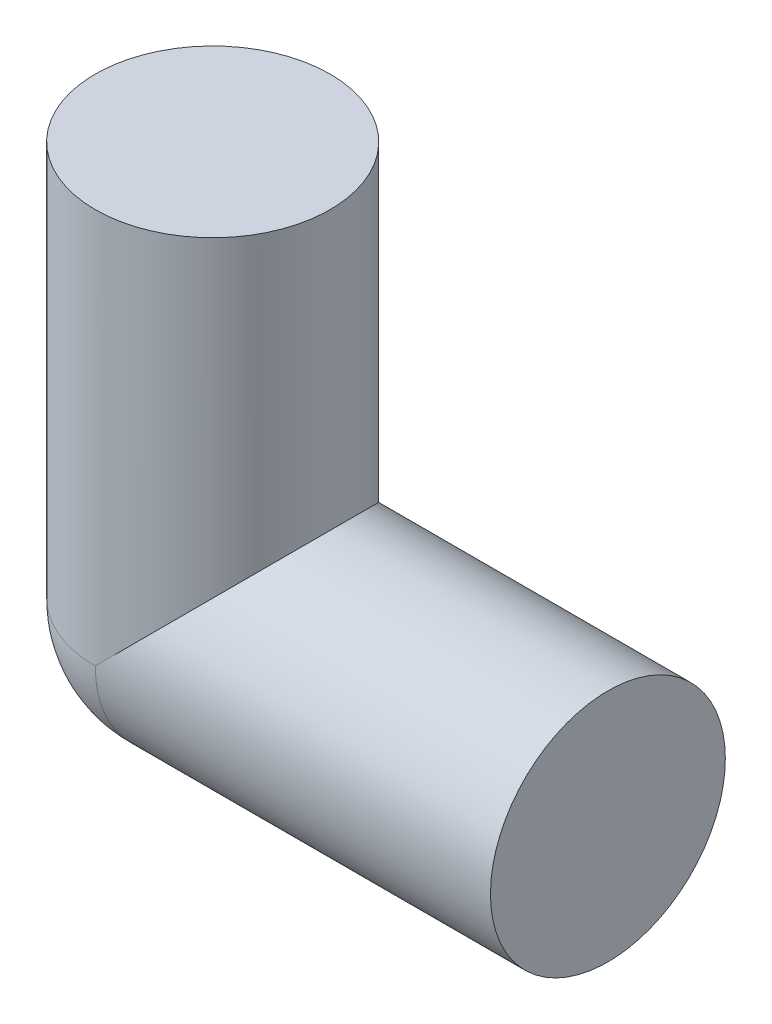
from build123d import *

# Parameters (mm, degrees)
SKETCH1_R           = 8
BOSS_EXTRUDE1_DEPTH = 26.924
SKETCH2_R           = 8
BOSS_EXTRUDE2_DEPTH = 26.924
REVOLVE1_ANGLE      = 90


with BuildPart() as part:
    # Sketch1 → Boss-Extrude1 (new body)
    with BuildSketch(Plane(origin=(0, 0, 0), x_dir=(1, 0, 0), z_dir=(0, 1, 0))):
        Circle(SKETCH1_R)
    extrude(amount=BOSS_EXTRUDE1_DEPTH)

    # Sketch2 → Boss-Extrude2 (add)
    with BuildSketch(Plane(origin=(0, 0, 0), x_dir=(0, 0, -1), z_dir=(1, 0, 0))):
        Circle(SKETCH2_R)
    extrude(amount=BOSS_EXTRUDE2_DEPTH)

    # Sketch3 → Revolve1 (revolve)
    with BuildSketch(Plane.ZY):
        with BuildLine():
            Line((-8, 0), (8, 0))
            ThreePointArc((8, 0), (0, -8), (-8, 0))
        make_face()
    revolve(axis=Axis((0, 0, 0), (0, 0, -1)), revolution_arc=REVOLVE1_ANGLE)


solid = part.part
